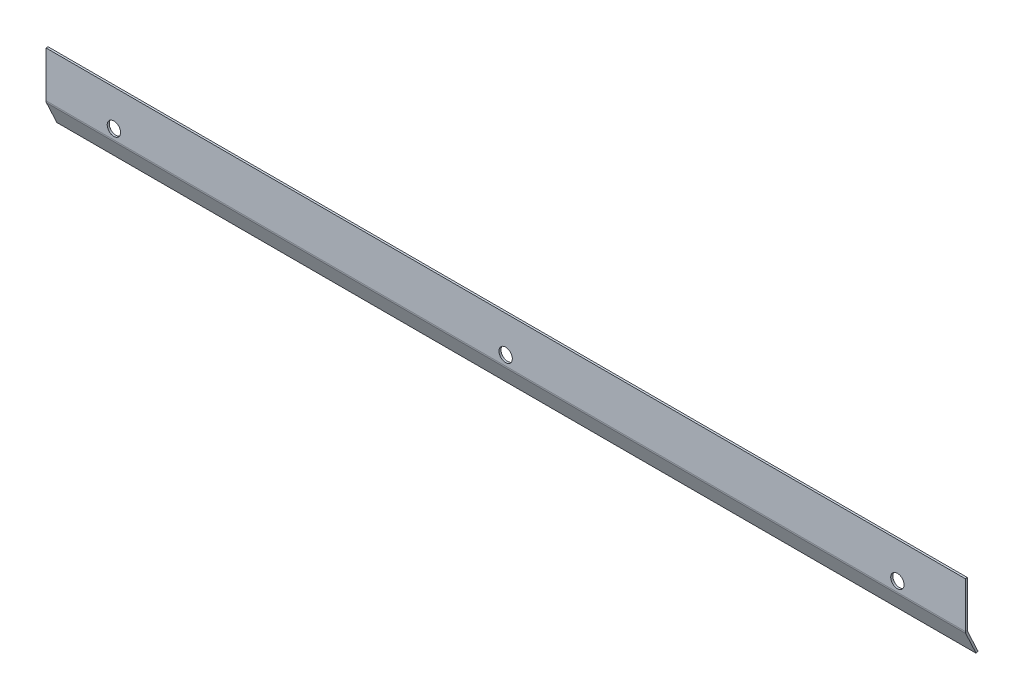
from build123d import *

# Parameters (mm, degrees)
SKETCH_1_W               = 357.45
SKETCH_1_H               = 18
EXTRUDE_1_DEPTH          = 0.8
SKETCH_8_R               = 2.6
CUT_EXTRUDE_1_DEPTH      = 179.953249831
SM_START                 = -178.725
SM_EDGE_FLANGE_1_DEPTH   = 357.45
SM_EDGE_FLANGE_1_2_DEPTH = 357.45
SKETCH_12_R              = 2.6
CUT_EXTRUDE_2_DEPTH      = 10


# Read off the part's stored shape, not the designer's step: Ребро-кромка1
with BuildPart() as part:
    # Sketch 1 → Вытянуть1 (new body)
    with BuildSketch(Plane.XY):
        Rectangle(SKETCH_1_W, SKETCH_1_H)
    extrude(amount=EXTRUDE_1_DEPTH)

    # Эскиз8 → Вырез-Вытянуть1 (cut, through all)
    with BuildSketch(Plane.XY.offset(0.8)):
        with Locations((152.325, -5)):
            Circle(SKETCH_8_R)
        with Locations((-152.325, -5)):
            Circle(SKETCH_8_R)
    extrude(amount=-CUT_EXTRUDE_1_DEPTH, mode=Mode.SUBTRACT)

    # Ребро-кромка1 outline → Ребро-кромка1 (cut)
    with BuildSketch(Plane.YZ.offset(SM_START)):
        with BuildLine():
            Line((-9, 0.8), (-9, 0.786295462))
            ThreePointArc((-9, 0.786295462), (-8.889364261, 0.796570599), (-8.778305337, 0.8))
            Line((-8.778305337, 0.8), (-9, 0.8))
        make_face()
    extrude(amount=SM_EDGE_FLANGE_1_DEPTH, mode=Mode.SUBTRACT)

    # Sm Edge Flange 1 2 outline → Sm Edge Flange 1 2 (add)
    with BuildSketch(Plane.YZ.offset(SM_START)):
        with BuildLine():
            ThreePointArc((-9, 0.786295462), (-9.275580767, 0.729947152), (-9.539018208, 0.631354017))
            Line((-9.539018208, 0.631354017), (-18.2404336, -3.426182617))
            Line((-18.2404336, -3.426182617), (-17.902338991, -4.151228847))
            Line((-17.902338991, -4.151228847), (-9.200923599, -0.093692213))
            ThreePointArc((-9.200923599, -0.093692213), (-8.994744951, -0.023703993), (-8.778305337, 0))
            Line((-8.778305337, 0), (-9, 0))
            Line((-9, 0), (-9, 0.786295462))
        make_face()
    extrude(amount=SM_EDGE_FLANGE_1_2_DEPTH)

    # Эскиз12 → Вырез-Вытянуть2 (cut)
    with BuildSketch(Plane.XY.offset(0.8)):
        with Locations((0, -5)):
            Circle(SKETCH_12_R)
    extrude(amount=-CUT_EXTRUDE_2_DEPTH, mode=Mode.SUBTRACT)


solid = part.part
